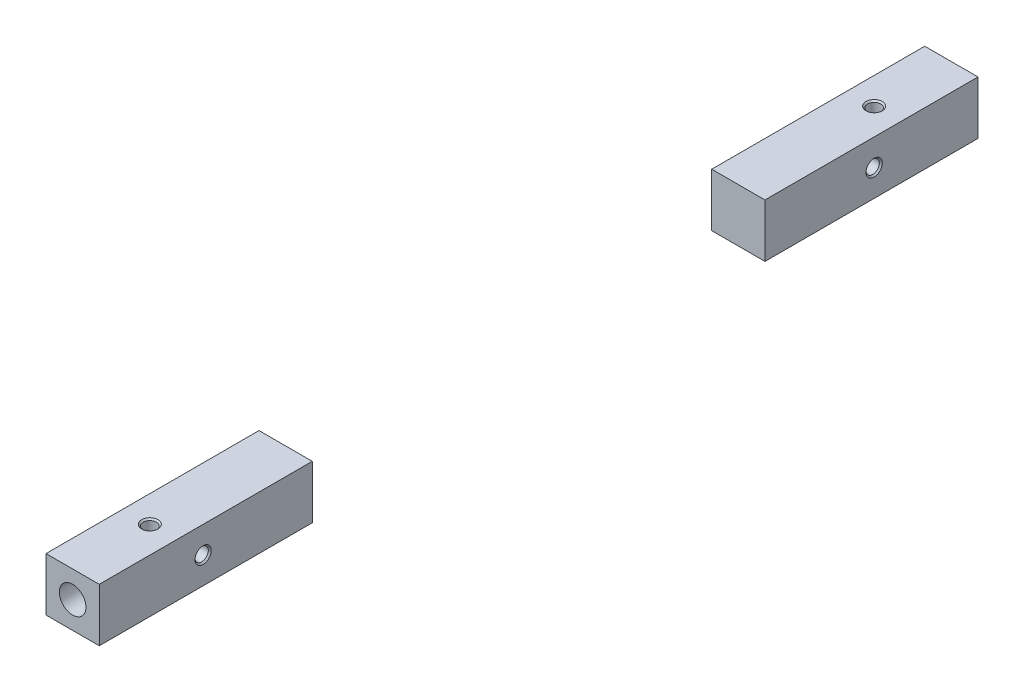
from build123d import *

# Parameters (mm, degrees)
ESQUISSE1_W                     = 10
ESQUISSE1_H                     = 10
BOSS_EXTRU_1_DEPTH              = 82.5
TROU_TARAUD_M3X0_51_D           = 2.5
TROU_TARAUD_M3X0_51_CSINK_D     = 3.05
TROU_TARAUD_M3X0_51_CSINK_ANGLE = 90
TROU_TARAUD_M3X0_52_D           = 2.5
TROU_TARAUD_M3X0_52_CSINK_D     = 3.05
TROU_TARAUD_M3X0_52_CSINK_ANGLE = 90
ESQUISSE6_R                     = 2.5
ENL_V_MAT_EXTRU_1_DEPTH         = 6
ENL_V_START                     = -6
ESQUISSE7_R                     = 2.5
ENL_V_MAT_EXTRU_2_DEPTH         = 6
ESQUISSE8_W                     = 10
ESQUISSE8_H                     = 85
ENL_V_MAT_EXTRU_3_DEPTH         = 84.254129027


with BuildPart() as part:
    # Esquisse1 → Boss.-Extru.1 (new, symmetric)
    with BuildSketch(Plane.XY):
        Rectangle(ESQUISSE1_W, ESQUISSE1_H)
    extrude(amount=BOSS_EXTRU_1_DEPTH, both=True)

    # Trou taraudé M3x0.51 (through all)
    with Locations(Plane(origin=(5, 0, 0), x_dir=(0, 0, -1), z_dir=(1, 0, 0))):
        with Locations((63, 0), (-63, 0)):
            CounterSinkHole(TROU_TARAUD_M3X0_51_D / 2, TROU_TARAUD_M3X0_51_CSINK_D / 2, counter_sink_angle=TROU_TARAUD_M3X0_51_CSINK_ANGLE)

    # Trou taraudé M3x0.52 (through all)
    with Locations(Plane(origin=(0, 5, 0), x_dir=(1, 0, 0), z_dir=(0, 1, 0))):
        with Locations((0, 68), (0, -68)):
            CounterSinkHole(TROU_TARAUD_M3X0_52_D / 2, TROU_TARAUD_M3X0_52_CSINK_D / 2, counter_sink_angle=TROU_TARAUD_M3X0_52_CSINK_ANGLE)

    # Esquisse6 → Enlèv. mat.-Extru.1 (cut)
    with BuildSketch(Plane.XY.offset(82.5)):
        Circle(ESQUISSE6_R)
    extrude(amount=-ENL_V_MAT_EXTRU_1_DEPTH, mode=Mode.SUBTRACT)

    # Esquisse7 → Enlèv. mat.-Extru.2 (cut)
    with BuildSketch(Plane(origin=(0, 0, -82.5), x_dir=(-1, 0, 0), z_dir=(0, 0, -1)).offset(ENL_V_START)):
        Circle(ESQUISSE7_R)
    extrude(amount=ENL_V_MAT_EXTRU_2_DEPTH, mode=Mode.SUBTRACT)

    # Esquisse8 → Enlèv. mat.-Extru.3 (cut, through all)
    with BuildSketch(Plane(origin=(0, 5, 0), x_dir=(1, 0, 0), z_dir=(0, 1, 0))):
        Rectangle(ESQUISSE8_W, ESQUISSE8_H)
    extrude(amount=-ENL_V_MAT_EXTRU_3_DEPTH, mode=Mode.SUBTRACT)


with BuildPart() as enl_v_mat_extru_3_piece_1:
    # of the separate pieces the step leaves, piece 1, a body of its own (enl_v_mat_extru_3_pieces)
    add(part.part.solids().sort_by_distance((-5, 5, -82.5))[0])


with BuildPart() as enl_v_mat_extru_3_piece_2:
    # of the separate pieces the step leaves, piece 2, a body of its own (enl_v_mat_extru_3_pieces)
    add(part.part.solids().sort_by_distance((-5, 5, 42.5))[0])


solid = Compound([enl_v_mat_extru_3_piece_1.part, enl_v_mat_extru_3_piece_2.part])
